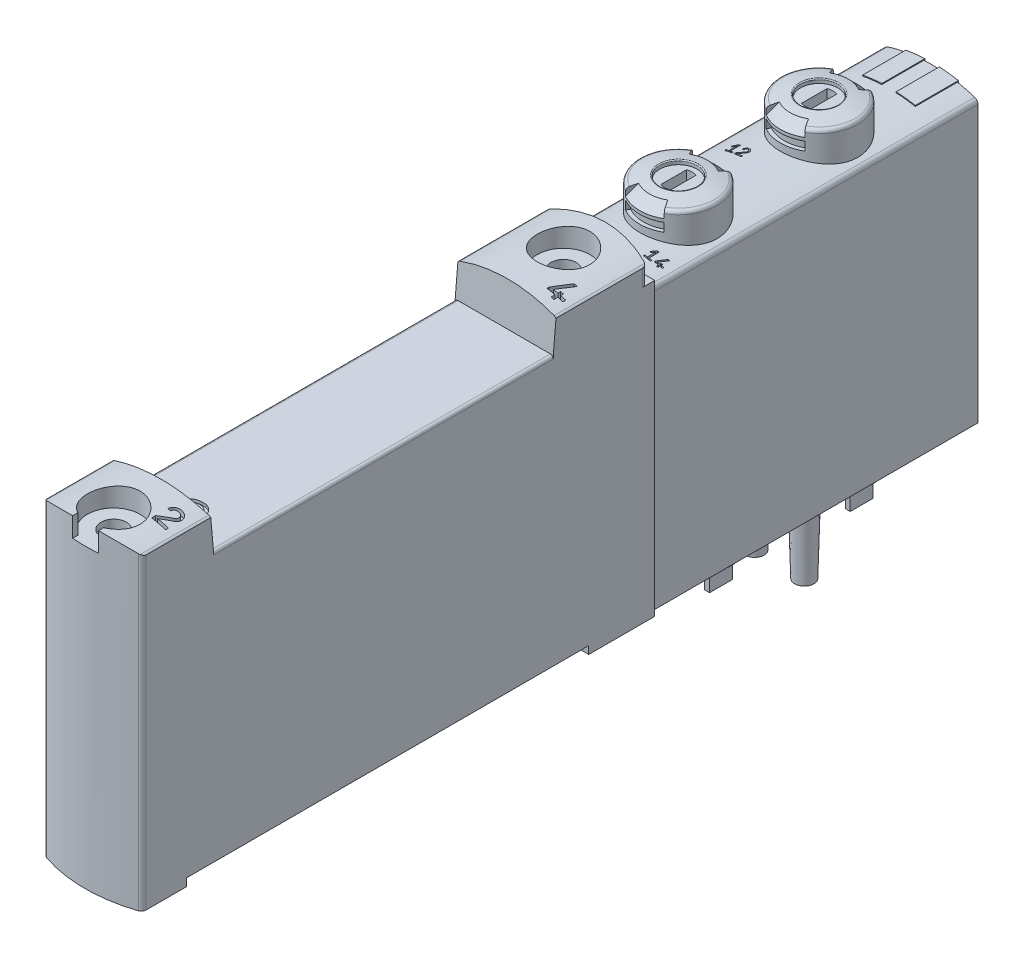
from build123d import *

# Parameters (mm, degrees)
AUFSATZ_LINEAR_AUSTRAGEN1_DEPTH       = 34
SCHNITT_LINEAR_AUSTRAGEN1_DEPTH       = 6
SCHNITT_LINEAR_AUSTRAGEN1_DEPTH_BACK  = 6
SKIZZE2_W                             = 34.1
SKIZZE2_H                             = 0.4
SCHNITT_LINEAR_AUSTRAGEN2_DEPTH       = 1.9
SCHNITT_LINEAR_AUSTRAGEN3_DEPTH       = 1.9
SKIZZE9_W                             = 0.5
SKIZZE9_H                             = 2.4
AUFSATZ_LINEAR_AUSTRAGEN2_DEPTH       = 2.5
SKIZZE10_W                            = 0.5
SKIZZE10_H                            = 2.4
AUFSATZ_LINEAR_AUSTRAGEN3_DEPTH       = 2.5
SKIZZE11_W                            = 0.5
SKIZZE11_H                            = 2.4
AUFSATZ_LINEAR_AUSTRAGEN4_DEPTH       = 2.5
SKIZZE12_W                            = 0.5
SKIZZE12_H                            = 2.4
AUFSATZ_LINEAR_AUSTRAGEN5_DEPTH       = 2.5
SCHNITT_ROTATION1_ANGLE               = 30
SCHNITT_ROTATION1_OTHER_WAY_ANGLE     = 30
SCHNITT_ROTATION2_ANGLE               = 30
SCHNITT_ROTATION2_OTHER_WAY_ANGLE     = 30
SCHNITT_LINEAR_AUSTRAGEN4_DEPTH       = 1.7
SCHNITT_ROTATION3_ANGLE               = 30
SCHNITT_ROTATION3_OTHER_WAY_ANGLE     = 30
SCHNITT_ROTATION4_ANGLE               = 30
SCHNITT_ROTATION4_OTHER_WAY_ANGLE     = 30
SCHNITT_LINEAR_AUSTRAGEN5_DEPTH       = 1.7
AUFSATZ_LINEAR_AUSTRAGEN6_DEPTH       = 4.5
AUFSATZ_LINEAR_AUSTRAGEN7_DEPTH       = 4.5
AUFSATZ_LINEAR_AUSTRAGEN8_DEPTH       = 33.1
SCHNITT_LINEAR_AUSTRAGEN6_DEPTH       = 10
SCHNITT_LINEAR_AUSTRAGEN6_DEPTH_BACK  = 10
SCHNITT_LINEAR_AUSTRAGEN7_DEPTH       = 10
SCHNITT_LINEAR_AUSTRAGEN8_DEPTH       = 10
SCHNITT_LINEAR_AUSTRAGEN8_DEPTH_BACK  = 10
SKIZZE26_W                            = 42
SKIZZE26_H                            = 1
SCHNITT_LINEAR_AUSTRAGEN9_DEPTH       = 55
SCHNITT_LINEAR_AUSTRAGEN10_DEPTH      = 35.5
SCHNITT_LINEAR_AUSTRAGEN11_DEPTH      = 2.1
SCHNITT_LINEAR_AUSTRAGEN11_DEPTH_BACK = 2.1
SKIZZE30_W                            = 1.325
SKIZZE30_H                            = 31
SCHNITT_LINEAR_AUSTRAGEN12_DEPTH      = 3.5
SCHNITT_LINEAR_AUSTRAGEN12_DEPTH_BACK = 3.5
SCHNITT_LINEAR_AUSTRAGEN13_DEPTH      = 3.5
SCHNITT_LINEAR_AUSTRAGEN13_DEPTH_BACK = 3.5
SCHNITT_LINEAR_AUSTRAGEN14_DEPTH      = 3.5
SCHNITT_LINEAR_AUSTRAGEN14_DEPTH_BACK = 3.5
SCHNITT_LINEAR_AUSTRAGEN15_DEPTH      = 3.5
SCHNITT_LINEAR_AUSTRAGEN15_DEPTH_BACK = 3.5
SCHNITT_LINEAR_AUSTRAGEN16_DEPTH      = 1
SCHNITT_LINEAR_AUSTRAGEN16_DEPTH_BACK = 1
SCHNITT_LINEAR_AUSTRAGEN17_DEPTH      = 1
SCHNITT_LINEAR_AUSTRAGEN17_DEPTH_BACK = 1
SCHNITT_LINEAR_AUSTRAGEN18_DEPTH      = 4.5
SCHNITT_LINEAR_AUSTRAGEN18_DEPTH_BACK = 4.5


with BuildPart() as part:
    # Skizze1 → Aufsatz-Linear austragen1 (new body)
    with BuildSketch(Plane.XY.offset(-23.2)):
        with BuildLine():
            Line((-4.9, 29.216294728), (-4.9, 0))
            Line((-4.9, 0), (4.9, 0))
            Line((4.9, 0), (4.9, 29.216294728))
            ThreePointArc((4.9, 29.216294728), (4.803647166, 29.511369236), (4.551724138, 29.692718684))
            ThreePointArc((4.551724138, 29.692718684), (0, 30.4), (-4.551724138, 29.692718684))
            ThreePointArc((-4.551724138, 29.692718684), (-4.803647166, 29.511369236), (-4.9, 29.216294728))
        make_face()
    extrude(amount=AUFSATZ_LINEAR_AUSTRAGEN1_DEPTH)

    # Skizze2 → Schnitt-Linear austragen1 (cut, two sides: drawn at the far end of the back side and taken through both)
    with BuildSketch(Plane(origin=(0, 0, 0), x_dir=(0, 0, -1), z_dir=(1, 0, 0)).offset(-SCHNITT_LINEAR_AUSTRAGEN1_DEPTH_BACK)):
        with Locations((6.17, 0.2)):
            Rectangle(SKIZZE2_W, SKIZZE2_H)
    extrude(amount=SCHNITT_LINEAR_AUSTRAGEN1_DEPTH + SCHNITT_LINEAR_AUSTRAGEN1_DEPTH_BACK, mode=Mode.SUBTRACT)

    # Skizze3 → Schnitt-Linear austragen2 (cut)
    with BuildSketch(Plane(origin=(0, 0, 0), x_dir=(1, 0, 0), z_dir=(0, 1, 0))):
        with BuildLine():
            Line((-3.15, 2.465258607), (-3.15, -2.465258607))
            ThreePointArc((-3.15, -2.465258607), (0, -4), (3.15, -2.465258607))
            Line((3.15, -2.465258607), (3.15, 2.465258607))
            ThreePointArc((3.15, 2.465258607), (0, 4), (-3.15, 2.465258607))
        make_face()
    extrude(amount=SCHNITT_LINEAR_AUSTRAGEN2_DEPTH, mode=Mode.SUBTRACT)

    # Skizze4 → Schnitt-Linear austragen3 (cut)
    with BuildSketch(Plane(origin=(0, 0, 0), x_dir=(1, 0, 0), z_dir=(0, 1, 0))):
        with BuildLine():
            Line((-3.15, 17.165258607), (-3.15, 12.234741393))
            ThreePointArc((-3.15, 12.234741393), (0, 10.7), (3.15, 12.234741393))
            Line((3.15, 12.234741393), (3.15, 17.165258607))
            ThreePointArc((3.15, 17.165258607), (0, 18.7), (-3.15, 17.165258607))
        make_face()
    extrude(amount=SCHNITT_LINEAR_AUSTRAGEN3_DEPTH, mode=Mode.SUBTRACT)

    # Skizze5 → Rotation1 (revolve)
    with BuildSketch(Plane(origin=(0, 0, 0), x_dir=(0, 0, -1), z_dir=(1, 0, 0))):
        Polygon((0, 2.1), (3.05, 2.1), (3.05, 1.1), (2.25, 1.1), (2.25, -1.4), (2.65, -1.4), (2.65, -1.72), (2.430606898, -2.1), (0, -2.1), align=None)
    revolve(axis=Axis((0, -2.1, 0), (0, 1, 0)))

    # Skizze6 → Rotation2 (revolve)
    with BuildSketch(Plane(origin=(0, 0, 0), x_dir=(0, 0, -1), z_dir=(1, 0, 0))):
        Polygon((14.7, 2.1), (17.75, 2.1), (17.75, 1.1), (16.95, 1.1), (16.95, -1.4), (17.35, -1.4), (17.35, -1.72), (17.130606898, -2.1), (14.7, -2.1), align=None)
    revolve(axis=Axis((0, -2.1, -14.7), (0, 1, 0)))

    # Skizze7 → Rotation3 (revolve)
    with BuildSketch(Plane.XY.offset(-7.35)):
        with BuildLine():
            Line((2.6, 0.4), (3.8, 0.4))
            Line((3.8, 0.4), (3.6, -6.9))
            ThreePointArc((3.6, -6.9), (3.106540729, -7.021444616), (2.6, -7.06227766))
            Line((2.6, -7.06227766), (2.6, 0.4))
        make_face()
    revolve(axis=Axis((2.6, -7.06227766, -7.35), (0, 1, 0)))

    # Skizze8 → Rotation4 (revolve)
    with BuildSketch(Plane.XY.offset(-7.35)):
        with BuildLine():
            Line((-2.6, 0.4), (-1.4, 0.4))
            Line((-1.4, 0.4), (-1.6, -6.9))
            ThreePointArc((-1.6, -6.9), (-2.093459271, -7.021444616), (-2.6, -7.06227766))
            Line((-2.6, -7.06227766), (-2.6, 0.4))
        make_face()
    revolve(axis=Axis((-2.6, -7.06227766, -7.35), (0, 1, 0)))

    # Skizze9 → Aufsatz-Linear austragen2 (add)
    with BuildSketch(Plane(origin=(0, -2.1, 0), x_dir=(-1, 0, 0), z_dir=(0, -1, 0))):
        with Locations((-1, 0)):
            Rectangle(SKIZZE9_W, SKIZZE9_H)
    extrude(amount=AUFSATZ_LINEAR_AUSTRAGEN2_DEPTH)

    # Skizze10 → Aufsatz-Linear austragen3 (add)
    with BuildSketch(Plane(origin=(0, -2.1, 0), x_dir=(-1, 0, 0), z_dir=(0, -1, 0))):
        with Locations((1, 0)):
            Rectangle(SKIZZE10_W, SKIZZE10_H)
    extrude(amount=AUFSATZ_LINEAR_AUSTRAGEN3_DEPTH)

    # Skizze11 → Aufsatz-Linear austragen4 (add)
    with BuildSketch(Plane(origin=(0, -2.1, 0), x_dir=(-1, 0, 0), z_dir=(0, -1, 0))):
        with Locations((-1, 14.7)):
            Rectangle(SKIZZE11_W, SKIZZE11_H)
    extrude(amount=AUFSATZ_LINEAR_AUSTRAGEN4_DEPTH)

    # Skizze12 → Aufsatz-Linear austragen5 (add)
    with BuildSketch(Plane(origin=(0, -2.1, 0), x_dir=(-1, 0, 0), z_dir=(0, -1, 0))):
        with Locations((1, 14.7)):
            Rectangle(SKIZZE12_W, SKIZZE12_H)
    extrude(amount=AUFSATZ_LINEAR_AUSTRAGEN5_DEPTH)

    # Skizze13 → Rotation5 (revolve)
    with BuildSketch(Plane(origin=(0, 0, 0), x_dir=(0, 0, -1), z_dir=(1, 0, 0))):
        with BuildLine():
            Line((-3.2, 33.13), (-1.25, 33.13))
            Line((-1.25, 33.13), (-1.25, 33.458302748))
            ThreePointArc((-1.25, 33.458302748), (-1.215666434, 33.533721045), (-1.136241611, 33.55735176))
            ThreePointArc((-1.136241611, 33.55735176), (-0.288337313, 33.41469403), (0.55, 33.223687548))
            ThreePointArc((0.55, 33.223687548), (0.766227766, 33.081338188), (0.85, 32.836389214))
            Line((0.85, 32.836389214), (0.85, 28.4))
            Line((0.85, 28.4), (-3.2, 28.4))
            Line((-3.2, 28.4), (-3.2, 33.13))
        make_face()
    revolve(axis=Axis((0, 28.4, 3.2), (0, 1, 0)))

    # Skizze14 → Rotation6 (revolve)
    with BuildSketch(Plane(origin=(0, 0, 0), x_dir=(0, 0, -1), z_dir=(1, 0, 0))):
        with BuildLine():
            Line((11.5, 33.13), (13.45, 33.13))
            Line((13.45, 33.13), (13.45, 33.458302748))
            ThreePointArc((13.45, 33.458302748), (13.484333566, 33.533721045), (13.563758389, 33.55735176))
            ThreePointArc((13.563758389, 33.55735176), (14.411662687, 33.41469403), (15.25, 33.223687548))
            ThreePointArc((15.25, 33.223687548), (15.466227766, 33.081338188), (15.55, 32.836389214))
            Line((15.55, 32.836389214), (15.55, 28.4))
            Line((15.55, 28.4), (11.5, 28.4))
            Line((11.5, 28.4), (11.5, 33.13))
        make_face()
    revolve(axis=Axis((0, 28.4, -11.5), (0, 1, 0)))

    # Skizze15 → Schnitt-Rotation1 (revolve, cut)
    with BuildSketch(Plane(origin=(0, 0, 0), x_dir=(0, 0, -1), z_dir=(1, 0, 0))):
        Polygon((-0.47, 33.7), (0.9, 32.33), (0.9, 32.05), (0.45, 32.05), (0.45, 31.15), (0.9, 31.15), (0.9, 30.5), (1.3, 30.5), (1.3, 33.7), align=None)
    revolve(axis=Axis((0, 30.5, 3.2), (0, -1, 0)), revolution_arc=SCHNITT_ROTATION1_ANGLE, mode=Mode.SUBTRACT)

    # Skizze15 → Schnitt-Rotation1 other way (revolve, cut)
    with BuildSketch(Plane(origin=(0, 0, 0), x_dir=(0, 0, -1), z_dir=(1, 0, 0))):
        Polygon((-0.47, 33.7), (0.9, 32.33), (0.9, 32.05), (0.45, 32.05), (0.45, 31.15), (0.9, 31.15), (0.9, 30.5), (1.3, 30.5), (1.3, 33.7), align=None)
    revolve(axis=Axis((0, 30.5, 3.2), (0, 1, 0)), revolution_arc=SCHNITT_ROTATION1_OTHER_WAY_ANGLE, mode=Mode.SUBTRACT)

    # Skizze16 → Schnitt-Rotation2 (revolve, cut)
    with BuildSketch(Plane(origin=(0, 0, 0), x_dir=(0, 0, -1), z_dir=(1, 0, 0))):
        Polygon((-7.7, 30.5), (-7.3, 30.5), (-7.3, 31.15), (-6.85, 31.15), (-6.85, 32.05), (-7.3, 32.05), (-7.3, 32.33), (-5.93, 33.7), (-7.7, 33.7), align=None)
    revolve(axis=Axis((0, 33.7, 3.2), (0, 1, 0)), revolution_arc=SCHNITT_ROTATION2_ANGLE, mode=Mode.SUBTRACT)

    # Skizze16 → Schnitt-Rotation2 other way (revolve, cut)
    with BuildSketch(Plane(origin=(0, 0, 0), x_dir=(0, 0, -1), z_dir=(1, 0, 0))):
        Polygon((-7.7, 30.5), (-7.3, 30.5), (-7.3, 31.15), (-6.85, 31.15), (-6.85, 32.05), (-7.3, 32.05), (-7.3, 32.33), (-5.93, 33.7), (-7.7, 33.7), align=None)
    revolve(axis=Axis((0, 33.7, 3.2), (0, -1, 0)), revolution_arc=SCHNITT_ROTATION2_OTHER_WAY_ANGLE, mode=Mode.SUBTRACT)

    # Skizze17 → Schnitt-Linear austragen4 (cut)
    with BuildSketch(Plane(origin=(0, 33.13, 0), x_dir=(1, 0, 0), z_dir=(0, 1, 0))):
        with BuildLine():
            Line((0.5, -4.534400615), (0.5, -1.865599385))
            ThreePointArc((0.5, -1.865599385), (0, -1.775), (-0.5, -1.865599385))
            Line((-0.5, -1.865599385), (-0.5, -4.534400615))
            ThreePointArc((-0.5, -4.534400615), (0, -4.625), (0.5, -4.534400615))
        make_face()
    extrude(amount=-SCHNITT_LINEAR_AUSTRAGEN4_DEPTH, mode=Mode.SUBTRACT)

    # Skizze18 → Schnitt-Rotation3 (revolve, cut)
    with BuildSketch(Plane(origin=(0, 0, 0), x_dir=(0, 0, -1), z_dir=(1, 0, 0))):
        Polygon((14.23, 33.7), (15.6, 32.33), (15.6, 32.05), (15.15, 32.05), (15.15, 31.15), (15.6, 31.15), (15.6, 30.5), (16, 30.5), (16, 33.7), align=None)
    revolve(axis=Axis((0, 30.5, -11.5), (0, -1, 0)), revolution_arc=SCHNITT_ROTATION3_ANGLE, mode=Mode.SUBTRACT)

    # Skizze18 → Schnitt-Rotation3 other way (revolve, cut)
    with BuildSketch(Plane(origin=(0, 0, 0), x_dir=(0, 0, -1), z_dir=(1, 0, 0))):
        Polygon((14.23, 33.7), (15.6, 32.33), (15.6, 32.05), (15.15, 32.05), (15.15, 31.15), (15.6, 31.15), (15.6, 30.5), (16, 30.5), (16, 33.7), align=None)
    revolve(axis=Axis((0, 30.5, -11.5), (0, 1, 0)), revolution_arc=SCHNITT_ROTATION3_OTHER_WAY_ANGLE, mode=Mode.SUBTRACT)

    # Skizze19 → Schnitt-Rotation4 (revolve, cut)
    with BuildSketch(Plane(origin=(0, 0, 0), x_dir=(0, 0, -1), z_dir=(1, 0, 0))):
        Polygon((7, 30.5), (7.4, 30.5), (7.4, 31.15), (7.85, 31.15), (7.85, 32.05), (7.4, 32.05), (7.4, 32.33), (8.77, 33.7), (7, 33.7), align=None)
    revolve(axis=Axis((0, 33.7, -11.5), (0, 1, 0)), revolution_arc=SCHNITT_ROTATION4_ANGLE, mode=Mode.SUBTRACT)

    # Skizze19 → Schnitt-Rotation4 other way (revolve, cut)
    with BuildSketch(Plane(origin=(0, 0, 0), x_dir=(0, 0, -1), z_dir=(1, 0, 0))):
        Polygon((7, 30.5), (7.4, 30.5), (7.4, 31.15), (7.85, 31.15), (7.85, 32.05), (7.4, 32.05), (7.4, 32.33), (8.77, 33.7), (7, 33.7), align=None)
    revolve(axis=Axis((0, 33.7, -11.5), (0, -1, 0)), revolution_arc=SCHNITT_ROTATION4_OTHER_WAY_ANGLE, mode=Mode.SUBTRACT)

    # Skizze20 → Schnitt-Linear austragen5 (cut)
    with BuildSketch(Plane(origin=(0, 33.13, 0), x_dir=(1, 0, 0), z_dir=(0, 1, 0))):
        with BuildLine():
            Line((0.5, 10.165599385), (0.5, 12.834400615))
            ThreePointArc((0.5, 12.834400615), (0, 12.925), (-0.5, 12.834400615))
            Line((-0.5, 12.834400615), (-0.5, 10.165599385))
            ThreePointArc((-0.5, 10.165599385), (0, 10.075), (0.5, 10.165599385))
        make_face()
    extrude(amount=-SCHNITT_LINEAR_AUSTRAGEN5_DEPTH, mode=Mode.SUBTRACT)

    # Skizze21 → Aufsatz-Linear austragen6 (add)
    with BuildSketch(Plane.XY.offset(-23.3)):
        with BuildLine():
            Line((0.75, 30.481362671), (0.75, 27))
            Line((0.75, 27), (2.75, 27))
            Line((2.75, 27), (2.75, 30.247474533))
            ThreePointArc((2.75, 30.247474533), (1.753903052, 30.397793974), (0.75, 30.481362671))
        make_face()
    extrude(amount=AUFSATZ_LINEAR_AUSTRAGEN6_DEPTH)

    # Skizze22 → Aufsatz-Linear austragen7 (add)
    with BuildSketch(Plane.XY.offset(-23.3)):
        with BuildLine():
            Line((-2.75, 30.247474533), (-2.75, 27))
            Line((-2.75, 27), (-0.75, 27))
            Line((-0.75, 27), (-0.75, 30.481362671))
            ThreePointArc((-0.75, 30.481362671), (-1.753903052, 30.397793974), (-2.75, 30.247474533))
        make_face()
    extrude(amount=AUFSATZ_LINEAR_AUSTRAGEN7_DEPTH)

    # Skizze23 → Aufsatz-Linear austragen8 (add)
    with BuildSketch(Plane(origin=(0, 0, 0), x_dir=(1, 0, 0), z_dir=(0, 1, 0))):
        with BuildLine():
            Line((5.125, -63.942611651), (5.125, -10.8))
            Line((5.125, -10.8), (-5.125, -10.8))
            Line((-5.125, -10.8), (-5.125, -63.942611651))
            ThreePointArc((-5.125, -63.942611651), (-5.031042719, -64.234380927), (-4.784482759, -64.416494812))
            ThreePointArc((-4.784482759, -64.416494812), (0, -65.2), (4.784482759, -64.416494812))
            ThreePointArc((4.784482759, -64.416494812), (5.031042719, -64.234380927), (5.125, -63.942611651))
        make_face()
    extrude(amount=AUFSATZ_LINEAR_AUSTRAGEN8_DEPTH)

    # Skizze24 → Schnitt-Linear austragen6 (cut, two sides: drawn at the far end of the back side and taken through both)
    with BuildSketch(Plane(origin=(0, 0, 0), x_dir=(0, 0, -1), z_dir=(1, 0, 0)).offset(-SCHNITT_LINEAR_AUSTRAGEN6_DEPTH_BACK)):
        Polygon((-57.774886635, 38.9), (-56.9, 28.9), (-21.4, 28.9), (-20.525113365, 38.9), align=None)
    extrude(amount=SCHNITT_LINEAR_AUSTRAGEN6_DEPTH + SCHNITT_LINEAR_AUSTRAGEN6_DEPTH_BACK, mode=Mode.SUBTRACT)

    # Skizze25 → Schnitt-Linear austragen7 (cut)
    with BuildSketch(Plane(origin=(0, 30.4, 0), x_dir=(1, 0, 0), z_dir=(0, 1, 0))):
        with BuildLine():
            Line((-5.125, -8.8), (-5.125, -12.057388349))
            ThreePointArc((-5.125, -12.057388349), (-5.031042719, -11.765619073), (-4.784482759, -11.583505188))
            ThreePointArc((-4.784482759, -11.583505188), (0, -10.8), (4.784482759, -11.583505188))
            ThreePointArc((4.784482759, -11.583505188), (5.031042719, -11.765619073), (5.125, -12.057388349))
            Line((5.125, -12.057388349), (5.125, -8.8))
            Line((5.125, -8.8), (-5.125, -8.8))
        make_face()
    extrude(amount=SCHNITT_LINEAR_AUSTRAGEN7_DEPTH, mode=Mode.SUBTRACT)

    # Skizze26 → Schnitt-Linear austragen8 (cut, two sides: drawn at the far end of the back side and taken through both)
    with BuildSketch(Plane(origin=(0, 0, 0), x_dir=(0, 0, -1), z_dir=(1, 0, 0)).offset(-SCHNITT_LINEAR_AUSTRAGEN8_DEPTH_BACK)):
        with Locations((-38.7, 0.3)):
            Rectangle(SKIZZE26_W, SKIZZE26_H)
    extrude(amount=SCHNITT_LINEAR_AUSTRAGEN8_DEPTH + SCHNITT_LINEAR_AUSTRAGEN8_DEPTH_BACK, mode=Mode.SUBTRACT)

    # Skizze27 → Schnitt-Linear austragen9 (cut)
    with BuildSketch(Plane.XY.offset(10.8)):
        with BuildLine():
            Line((-5.25, 35.1), (-5.25, 31.799908759))
            ThreePointArc((-5.25, 31.799908759), (-5.157367495, 32.089825513), (-4.913793103, 32.272319406))
            ThreePointArc((-4.913793103, 32.272319406), (0, 33.1), (4.913793103, 32.272319406))
            ThreePointArc((4.913793103, 32.272319406), (5.157367495, 32.089825513), (5.25, 31.799908759))
            Line((5.25, 31.799908759), (5.25, 35.1))
            Line((5.25, 35.1), (-5.25, 35.1))
        make_face()
    extrude(amount=SCHNITT_LINEAR_AUSTRAGEN9_DEPTH, mode=Mode.SUBTRACT)

    # Skizze28 → Schnitt-Linear austragen10 (cut)
    with BuildSketch(Plane.XY.offset(21.4)):
        with BuildLine():
            Line((-4.825, 28.9), (4.825, 28.9))
            ThreePointArc((4.825, 28.9), (5.037132034, 28.812132034), (5.125, 28.6))
            Line((5.125, 28.6), (5.125, 33.6))
            Line((5.125, 33.6), (-5.125, 33.6))
            Line((-5.125, 33.6), (-5.125, 28.6))
            ThreePointArc((-5.125, 28.6), (-5.037132034, 28.812132034), (-4.825, 28.9))
        make_face()
    extrude(amount=SCHNITT_LINEAR_AUSTRAGEN10_DEPTH, mode=Mode.SUBTRACT)

    # Skizze29 → Schnitt-Linear austragen11 (cut, two sides: drawn at the far end of the back side and taken through both)
    with BuildSketch(Plane(origin=(0, 33.1, 0), x_dir=(1, 0, 0), z_dir=(0, 1, 0)).offset(-SCHNITT_LINEAR_AUSTRAGEN11_DEPTH_BACK)):
        with BuildLine():
            Line((-1.35, -64.59582971), (-1.35, -66))
            Line((-1.35, -66), (1.35, -66))
            Line((1.35, -66), (1.35, -64.59582971))
            ThreePointArc((1.35, -64.59582971), (0, -59.45), (-1.35, -64.59582971))
        make_face()
    extrude(amount=SCHNITT_LINEAR_AUSTRAGEN11_DEPTH + SCHNITT_LINEAR_AUSTRAGEN11_DEPTH_BACK, mode=Mode.SUBTRACT)

    # Skizze30 → Schnitt-Rotation5 (revolve, cut)
    with BuildSketch(Plane(origin=(0, 0, 0), x_dir=(0, 0, -1), z_dir=(1, 0, 0))):
        with Locations((-61.5375, 15.5)):
            Rectangle(SKIZZE30_W, SKIZZE30_H)
    revolve(axis=Axis((0, 0, 62.2), (0, 1, 0)), mode=Mode.SUBTRACT)

    # Skizze31 → Schnitt-Rotation6 (revolve, cut)
    with BuildSketch(Plane(origin=(0, 0, 0), x_dir=(0, 0, -1), z_dir=(1, 0, 0))):
        Polygon((-15.2, 33.2), (-12.45, 33.2), (-12.45, 31), (-13.875, 31), (-13.875, 0), (-15.2, 0), align=None)
    revolve(axis=Axis((0, 0, 15.2), (0, 1, 0)), mode=Mode.SUBTRACT)

    # Skizze32 → Schnitt-Rotation7 (revolve, cut)
    with BuildSketch(Plane(origin=(0, 0, 0), x_dir=(0, 0, -1), z_dir=(1, 0, 0))):
        Polygon((-40.2, 9.8), (-38.1, 9.8), (-38.1, 1.8), (-37.4, 1.8), (-37.4, 0.8), (-40.2, 0.8), align=None)
    revolve(axis=Axis((0, 0.8, 40.2), (0, 1, 0)), mode=Mode.SUBTRACT)

    # Skizze33 → Schnitt-Rotation8 (revolve, cut)
    with BuildSketch(Plane(origin=(-1.55, 0, 0), x_dir=(0, 0, -1), z_dir=(1, 0, 0))):
        Polygon((-29.1, 9.8), (-27, 9.8), (-27, 1.8), (-26.3, 1.8), (-26.3, 0.8), (-29.1, 0.8), align=None)
    revolve(axis=Axis((-1.55, 0.8, 29.1), (0, 1, 0)), mode=Mode.SUBTRACT)

    # Skizze34 → Schnitt-Rotation9 (revolve, cut)
    with BuildSketch(Plane(origin=(-1.55, 0, 0), x_dir=(0, 0, -1), z_dir=(1, 0, 0))):
        Polygon((-46.1, 9.8), (-44, 9.8), (-44, 1.8), (-43.3, 1.8), (-43.3, 0.8), (-46.1, 0.8), align=None)
    revolve(axis=Axis((-1.55, 0.8, 46.1), (0, 1, 0)), mode=Mode.SUBTRACT)

    # Skizze35 → Schnitt-Rotation10 (revolve, cut)
    with BuildSketch(Plane(origin=(1.55, 0, 0), x_dir=(0, 0, -1), z_dir=(1, 0, 0))):
        Polygon((-34.3, 9.8), (-32.2, 9.8), (-32.2, 1.8), (-31.5, 1.8), (-31.5, 0.8), (-34.3, 0.8), align=None)
    revolve(axis=Axis((1.55, 0.8, 34.3), (0, 1, 0)), mode=Mode.SUBTRACT)

    # Skizze36 → Schnitt-Rotation11 (revolve, cut)
    with BuildSketch(Plane(origin=(1.55, 0, 0), x_dir=(0, 0, -1), z_dir=(1, 0, 0))):
        Polygon((-51.3, 9.8), (-49.2, 9.8), (-49.2, 1.8), (-48.5, 1.8), (-48.5, 0.8), (-51.3, 0.8), align=None)
    revolve(axis=Axis((1.55, 0.8, 51.3), (0, 1, 0)), mode=Mode.SUBTRACT)

    # Skizze37 → Schnitt-Linear austragen12 (cut, two sides: drawn at the far end of the back side and taken through both)
    with BuildSketch(Plane(origin=(0, 33.1, 0), x_dir=(1, 0, 0), z_dir=(0, 1, 0)).offset(-SCHNITT_LINEAR_AUSTRAGEN12_DEPTH_BACK)):
        Polygon((-3.398476194, 5.738028118), (-3.297824684, 5.667551171), (-3.075, 5.985777799), (-3.075, 5.15), (-3.375, 5.15), (-3.375, 5), (-2.625, 5), (-2.625, 5.15), (-2.925, 5.15), (-2.925, 6.2), (-3.075, 6.2), align=None)
    extrude(amount=SCHNITT_LINEAR_AUSTRAGEN12_DEPTH + SCHNITT_LINEAR_AUSTRAGEN12_DEPTH_BACK, mode=Mode.SUBTRACT)

    # Skizze38 → Schnitt-Linear austragen13 (cut, two sides: drawn at the far end of the back side and taken through both)
    with BuildSketch(Plane(origin=(0, 33.1, 0), x_dir=(1, 0, 0), z_dir=(0, 1, 0)).offset(-SCHNITT_LINEAR_AUSTRAGEN13_DEPTH_BACK)):
        with BuildLine():
            Line((-2.3625, 5.8375), (-2.2125, 5.8375))
            ThreePointArc((-2.2125, 5.8375), (-1.915590111, 6.03251595), (-1.854559099, 5.682570356))
            Line((-1.854559099, 5.682570356), (-2.3625, 5.205738549))
            Line((-2.3625, 5.205738549), (-2.3625, 5))
            Line((-2.3625, 5), (-1.6375, 5))
            Line((-1.6375, 5), (-1.6375, 5.15))
            Line((-1.6375, 5.15), (-2.202713816, 5.15))
            Line((-2.202713816, 5.15), (-1.751894934, 5.573208255))
            ThreePointArc((-1.751894934, 5.573208255), (-1.85600666, 6.170174267), (-2.3625, 5.8375))
        make_face()
    extrude(amount=SCHNITT_LINEAR_AUSTRAGEN13_DEPTH + SCHNITT_LINEAR_AUSTRAGEN13_DEPTH_BACK, mode=Mode.SUBTRACT)

    # Skizze39 → Schnitt-Linear austragen14 (cut, two sides: drawn at the far end of the back side and taken through both)
    with BuildSketch(Plane(origin=(0, 33.1, 0), x_dir=(1, 0, 0), z_dir=(0, 1, 0)).offset(-SCHNITT_LINEAR_AUSTRAGEN14_DEPTH_BACK)):
        Polygon((2.101523806, -8.261971882), (2.202175316, -8.332448829), (2.425, -8.014222201), (2.425, -8.85), (2.125, -8.85), (2.125, -9), (2.875, -9), (2.875, -8.85), (2.575, -8.85), (2.575, -7.8), (2.425, -7.8), align=None)
    extrude(amount=SCHNITT_LINEAR_AUSTRAGEN14_DEPTH + SCHNITT_LINEAR_AUSTRAGEN14_DEPTH_BACK, mode=Mode.SUBTRACT)

    # Skizze40 → Schnitt-Linear austragen15 (cut, two sides: drawn at the far end of the back side and taken through both)
    with BuildSketch(Plane(origin=(0, 33.1, 0), x_dir=(1, 0, 0), z_dir=(0, 1, 0)).offset(-SCHNITT_LINEAR_AUSTRAGEN15_DEPTH_BACK)):
        Polygon((3.085, -8.8), (3.5, -8.8), (3.5, -9), (3.65, -9), (3.65, -8.8), (3.915, -8.8), (3.915, -8.65), (3.65, -8.65), (3.65, -8.5), (3.5, -8.5), (3.5, -8.65), (3.269946149, -8.65), (3.666307658, -7.8), (3.50080097, -7.8), (3.085, -8.691688058), align=None)
    extrude(amount=SCHNITT_LINEAR_AUSTRAGEN15_DEPTH + SCHNITT_LINEAR_AUSTRAGEN15_DEPTH_BACK, mode=Mode.SUBTRACT)

    # Skizze41 → Schnitt-Linear austragen16 (cut, two sides: drawn at the far end of the back side and taken through both)
    with BuildSketch(Plane(origin=(0, 33.1, 0), x_dir=(1, 0, 0), z_dir=(0, 1, 0)).offset(-SCHNITT_LINEAR_AUSTRAGEN16_DEPTH_BACK)):
        Polygon((2.67, -19.6), (3.5, -19.6), (3.5, -20), (3.8, -20), (3.8, -19.6), (4.33, -19.6), (4.33, -19.3), (3.8, -19.3), (3.8, -19), (3.5, -19), (3.5, -19.3), (3.039892297, -19.3), (3.832615316, -17.6), (3.501601941, -17.6), (2.67, -19.383376117), align=None)
    extrude(amount=SCHNITT_LINEAR_AUSTRAGEN16_DEPTH + SCHNITT_LINEAR_AUSTRAGEN16_DEPTH_BACK, mode=Mode.SUBTRACT)

    # Skizze42 → Schnitt-Linear austragen17 (cut, two sides: drawn at the far end of the back side and taken through both)
    with BuildSketch(Plane(origin=(0, 33.1, 0), x_dir=(1, 0, 0), z_dir=(0, 1, 0)).offset(-SCHNITT_LINEAR_AUSTRAGEN17_DEPTH_BACK)):
        with BuildLine():
            Line((2.775, -59.325), (3.075, -59.325))
            ThreePointArc((3.075, -59.325), (3.668819777, -58.9349681), (3.790881801, -59.634859287))
            Line((3.790881801, -59.634859287), (2.775, -60.588522903))
            Line((2.775, -60.588522903), (2.775, -61))
            Line((2.775, -61), (4.225, -61))
            Line((4.225, -61), (4.225, -60.7))
            Line((4.225, -60.7), (3.094572368, -60.7))
            Line((3.094572368, -60.7), (3.996210131, -59.85358349))
            ThreePointArc((3.996210131, -59.85358349), (3.787986679, -58.659651465), (2.775, -59.325))
        make_face()
    extrude(amount=SCHNITT_LINEAR_AUSTRAGEN17_DEPTH + SCHNITT_LINEAR_AUSTRAGEN17_DEPTH_BACK, mode=Mode.SUBTRACT)

    # Skizze43 → Schnitt-Linear austragen18 (cut, two sides: drawn at the far end of the back side and taken through both)
    with BuildSketch(Plane(origin=(0, 33.1, 0), x_dir=(1, 0, 0), z_dir=(0, 1, 0)).offset(-SCHNITT_LINEAR_AUSTRAGEN18_DEPTH_BACK)):
        with BuildLine():
            Line((1.02, -55.553862945), (1.02, -56))
            Line((1.02, -56), (1.38, -56))
            Line((1.38, -56), (1.38, -54.35))
            Line((1.38, -54.35), (0.06, -54.35))
            Line((0.06, -54.35), (0.06, -54.71))
            Line((0.06, -54.71), (1.02, -54.71))
            ThreePointArc((1.02, -54.71), (0, -55.64396289), (-1.02, -54.71))
            Line((-1.02, -54.71), (-1.02, -54.38))
            ThreePointArc((-1.02, -54.38), (-0.705256464, -53.674743536), (0, -53.36))
            ThreePointArc((0, -53.36), (0.607951421, -53.444980649), (1.02, -53.9))
            Line((1.02, -53.9), (1.38, -53.9))
            ThreePointArc((1.38, -53.9), (1.037108176, -53.308301869), (0.426672726, -53))
            Line((0.426672726, -53), (0, -53))
            ThreePointArc((0, -53), (-0.975807358, -53.404192642), (-1.38, -54.38))
            Line((-1.38, -54.38), (-1.38, -54.71))
            ThreePointArc((-1.38, -54.71), (-0.458722321, -55.924635517), (1.02, -55.553862945))
        make_face()
    extrude(amount=SCHNITT_LINEAR_AUSTRAGEN18_DEPTH + SCHNITT_LINEAR_AUSTRAGEN18_DEPTH_BACK, mode=Mode.SUBTRACT)


solid = part.part
